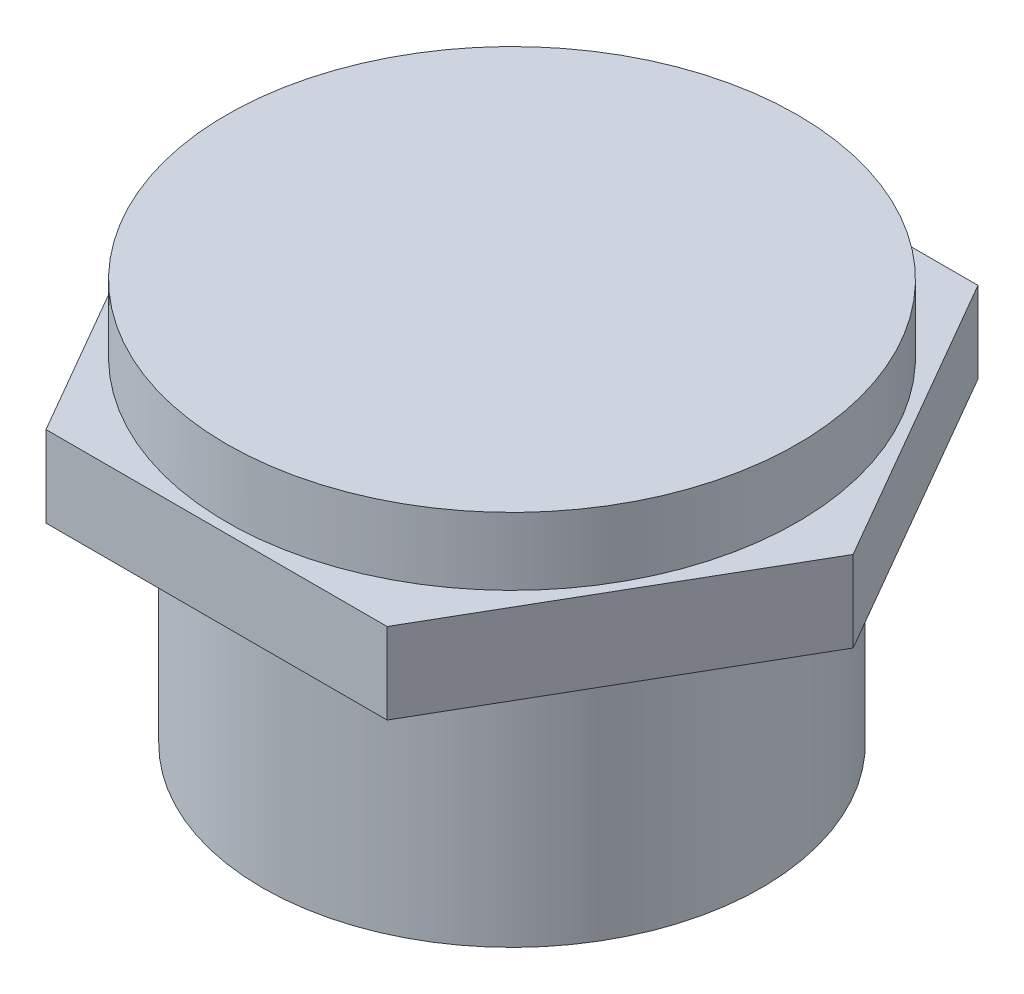
from build123d import *

# Parameters (mm, degrees)
SKETCH1_R           = 10.7315
BOSS_EXTRUDE1_DEPTH = 2.54
BOSS_EXTRUDE2_DEPTH = 3.048
SKETCH4_R           = 9.398
BOSS_EXTRUDE4_DEPTH = 9.525


with BuildPart() as part:
    # Sketch1 → Boss-Extrude1 (new body)
    with BuildSketch(Plane(origin=(0, 0, 0), x_dir=(1, 0, 0), z_dir=(0, 1, 0))):
        Circle(SKETCH1_R)
    extrude(amount=BOSS_EXTRUDE1_DEPTH)

    # Sketch2 → Boss-Extrude2 (add)
    with BuildSketch(Plane.XZ):
        Polygon((-12.831609733, 0), (-6.415804866, -11.1125), (6.415804866, -11.1125), (12.831609733, 0), (6.415804866, 11.1125), (-6.415804866, 11.1125), align=None)
    extrude(amount=BOSS_EXTRUDE2_DEPTH)

    # Sketch4 → Boss-Extrude4 (add)
    with BuildSketch(Plane.XZ.offset(3.048)):
        Circle(SKETCH4_R)
    extrude(amount=BOSS_EXTRUDE4_DEPTH)


solid = part.part
